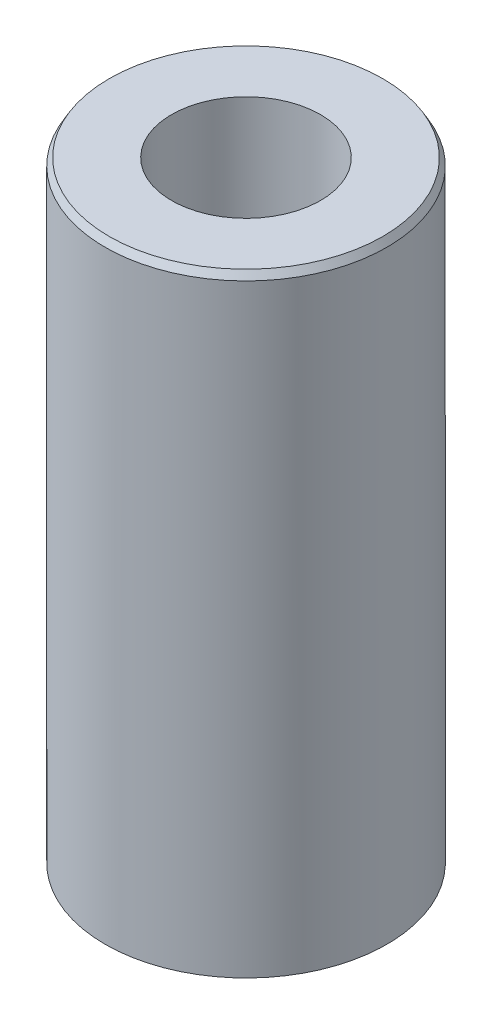
from build123d import *
from OCP.BRepFilletAPI import BRepFilletAPI_MakeChamfer

# Parameters (mm, degrees)
SKETCH1_R           = 27.5
BOSS_EXTRUDE1_DEPTH = 120.009170667
SKETCH2_R           = 14.535942031
CUT_EXTRUDE1_DEPTH  = 127.153482093
CHAMFER1_SIZE       = 1.412255339
CHAMFER1_SIZE2      = 0.815366


with BuildPart() as part:
    # Sketch1 → Boss-Extrude1 (new body)
    with BuildSketch(Plane(origin=(0, 0, 0), x_dir=(1, 0, 0), z_dir=(0, 1, 0))):
        Circle(SKETCH1_R)
    extrude(amount=BOSS_EXTRUDE1_DEPTH)

    # Sketch2 → Cut-Extrude1 (cut, through all)
    with BuildSketch(Plane(origin=(0, 0, 0), x_dir=(1, 0, 0), z_dir=(0, 1, 0))):
        Circle(SKETCH2_R)
    extrude(amount=CUT_EXTRUDE1_DEPTH, mode=Mode.SUBTRACT)

    # Chamfer1: one chamfer whose edges measure the first distance from different faces: ONE call of the kernel's chamfer builder (chamfer() names one face for all edges)
    chamfer1_edges_1 = [part.edges().sort_by_distance(p)[0] for p in [
        (-27.5, 120.009170667, 0),
    ]]
    chamfer1_side_1 = [part.faces().sort_by_distance(p)[0] for p in [
        (-27.5, 60.004585333, 0),
    ]]
    chamfer1_edges_2 = [part.edges().sort_by_distance(p)[0] for p in [
        (-27.5, 0, 0),
    ]]
    chamfer1_side_2 = [part.faces().sort_by_distance(p)[0] for p in [
        (-26.722182541, 0, 0),
    ]]
    chamfer1 = BRepFilletAPI_MakeChamfer(part.part.solid().wrapped)
    for e in chamfer1_edges_1:
        chamfer1.Add(CHAMFER1_SIZE, CHAMFER1_SIZE2, e.wrapped, chamfer1_side_1[0].wrapped)  # the first distance lies on this face
    for e in chamfer1_edges_2:
        chamfer1.Add(CHAMFER1_SIZE, CHAMFER1_SIZE2, e.wrapped, chamfer1_side_2[0].wrapped)  # the first distance lies on this face
    add(Compound.cast(chamfer1.Shape()), mode=Mode.REPLACE)


solid = part.part
